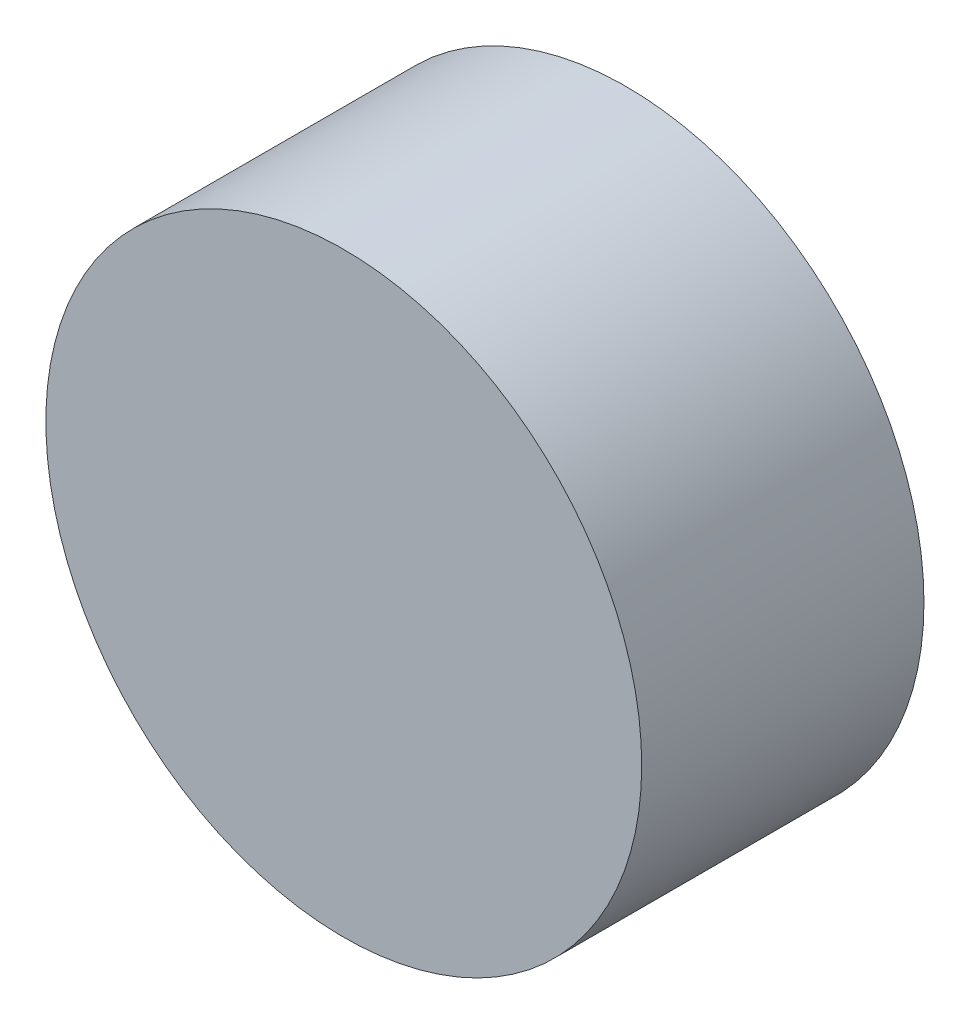
from build123d import *

# Parameters (mm, degrees)
ESBO_O1_R                = 38
RESSALTO_EXTRUS_O1_DEPTH = 36


with BuildPart() as part:
    # Esboço1 → Ressalto-extrusão1 (new body)
    with BuildSketch(Plane.XY):
        Circle(ESBO_O1_R)
    extrude(amount=RESSALTO_EXTRUS_O1_DEPTH)


solid = part.part
